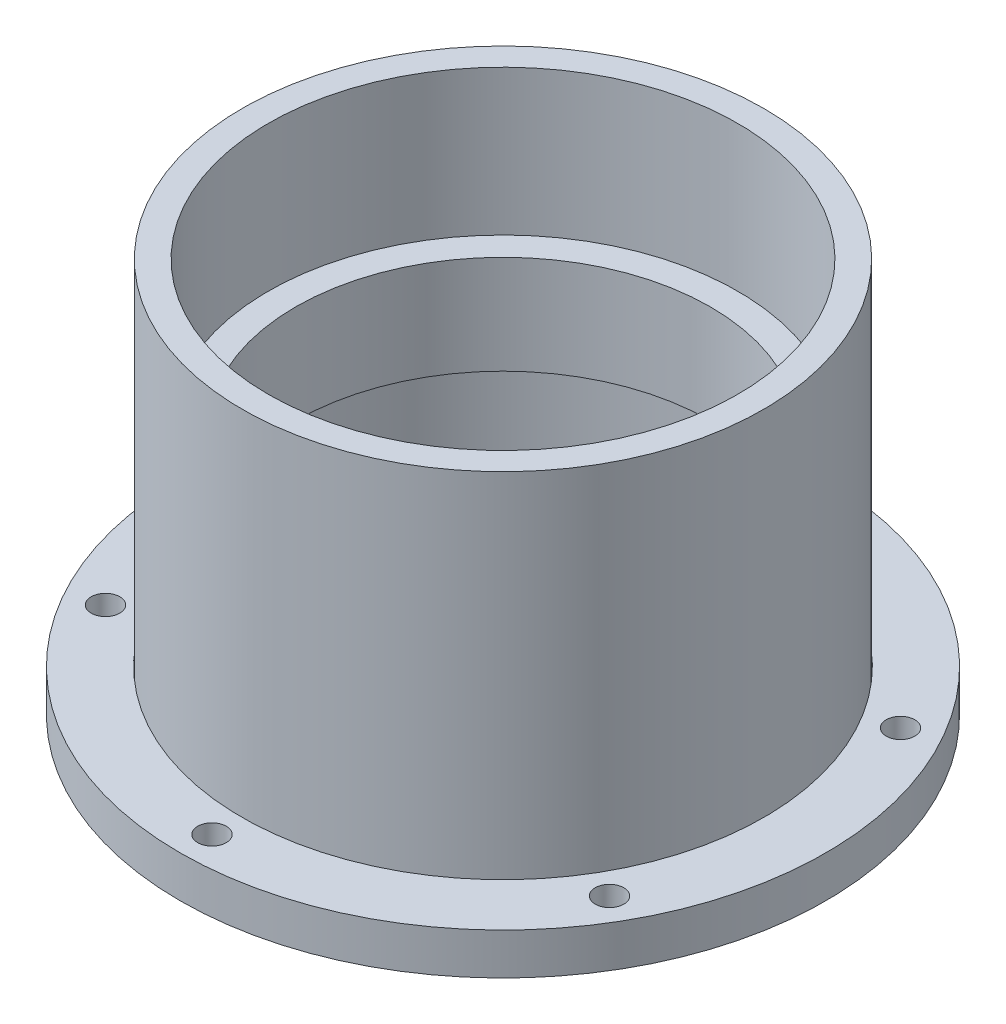
from build123d import *

# Parameters (mm, degrees)
SKETCH2_R           = 50.22
SKETCH2_R_2         = 45.22
BOSS_EXTRUDE1_DEPTH = 29
SKETCH3_R           = 50.22
SKETCH3_R_2         = 39.97
BOSS_EXTRUDE2_DEPTH = 19
SKETCH4_R           = 50.22
SKETCH4_R_2         = 45.22
BOSS_EXTRUDE3_DEPTH = 28
SKETCH6_R           = 62.2
SKETCH6_R_2         = 50.32
SKETCH6_R_3         = 2.75
BOSS_EXTRUDE4_DEPTH = 8


with BuildPart() as part:
    # Sketch2 → Boss-Extrude1 (new body)
    with BuildSketch(Plane(origin=(0, 0, 0), x_dir=(1, 0, 0), z_dir=(0, 1, 0))):
        Circle(SKETCH2_R)
        Circle(SKETCH2_R_2, mode=Mode.SUBTRACT)
    extrude(amount=BOSS_EXTRUDE1_DEPTH)

    # Sketch3 → Boss-Extrude2 (add)
    with BuildSketch(Plane(origin=(0, 29, 0), x_dir=(1, 0, 0), z_dir=(0, 1, 0))):
        Circle(SKETCH3_R)
        Circle(SKETCH3_R_2, mode=Mode.SUBTRACT)
    extrude(amount=BOSS_EXTRUDE2_DEPTH)

    # Sketch4 → Boss-Extrude3 (add)
    with BuildSketch(Plane(origin=(0, 48, 0), x_dir=(1, 0, 0), z_dir=(0, 1, 0))):
        Circle(SKETCH4_R)
        Circle(SKETCH4_R_2, mode=Mode.SUBTRACT)
    extrude(amount=BOSS_EXTRUDE3_DEPTH)


with BuildPart() as body_2:
    # Sketch6 → Boss-Extrude4 (new body)
    with BuildSketch(Plane.XZ):
        Circle(SKETCH6_R)
        Circle(SKETCH6_R_2, mode=Mode.SUBTRACT)
        with Locations((0, 56.06)):
            Circle(SKETCH6_R_3, mode=Mode.SUBTRACT)
        with Locations((-48.549384136, 28.03)):
            Circle(SKETCH6_R_3, mode=Mode.SUBTRACT)
        with Locations((-48.549384136, -28.03)):
            Circle(SKETCH6_R_3, mode=Mode.SUBTRACT)
        with Locations((48.549384136, 28.03)):
            Circle(SKETCH6_R_3, mode=Mode.SUBTRACT)
        with Locations((48.549384136, -28.03)):
            Circle(SKETCH6_R_3, mode=Mode.SUBTRACT)
        with Locations((0, -56.06)):
            Circle(SKETCH6_R_3, mode=Mode.SUBTRACT)
    extrude(amount=-BOSS_EXTRUDE4_DEPTH)


solid = Compound([part.part, body_2.part])
